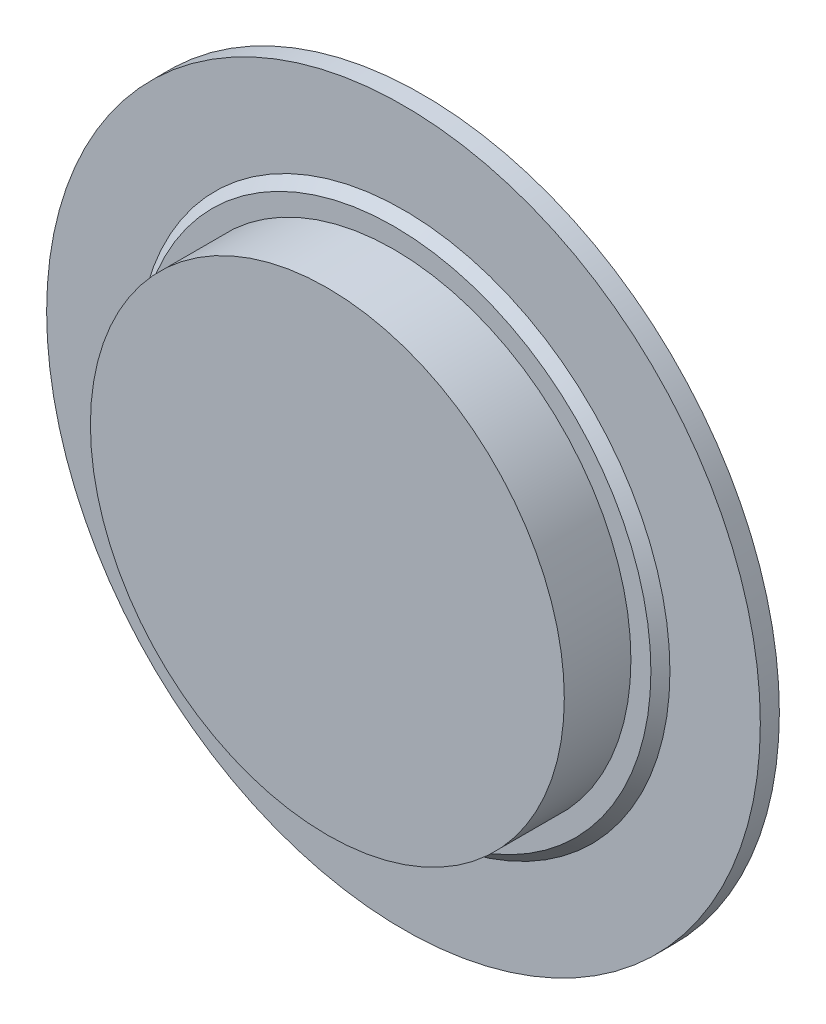
from build123d import *

# Parameters (mm, degrees)
SKETCH1_R           = 37.5
BOSS_EXTRUDE1_DEPTH = 2
SKETCH5_R           = 28
BOSS_EXTRUDE5_DEPTH = 1
SKETCH2_R           = 24.9
BOSS_EXTRUDE2_DEPTH = 7
CHAMFER1_SIZE       = 1


with BuildPart() as part:
    # Sketch1 → Boss-Extrude1 (new body)
    with BuildSketch(Plane.XY):
        Circle(SKETCH1_R)
    extrude(amount=BOSS_EXTRUDE1_DEPTH)

    # Sketch5 → Boss-Extrude5 (add)
    with BuildSketch(Plane.XY.offset(2)):
        Circle(SKETCH5_R)
    extrude(amount=BOSS_EXTRUDE5_DEPTH)

    # Sketch2 → Boss-Extrude2 (add)
    with BuildSketch(Plane.XY.offset(3)):
        Circle(SKETCH2_R)
    extrude(amount=BOSS_EXTRUDE2_DEPTH)

    # Chamfer1
    chamfer1_edges = [part.edges().sort_by_distance(p)[0] for p in [
        (-28, 0, 3),
    ]]
    chamfer(chamfer1_edges, length=CHAMFER1_SIZE - 0.0001)  # a hair under: the kernel refuses the full size


solid = part.part
